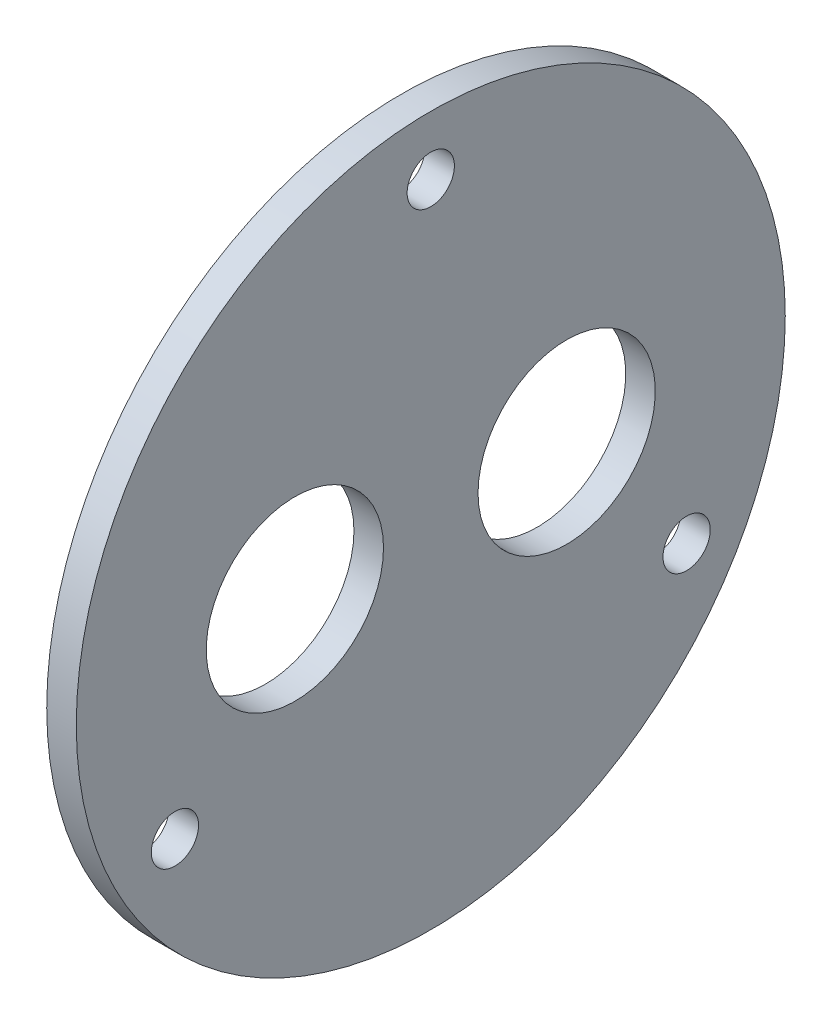
from build123d import *

# Parameters (mm, degrees)
SKETCH1_R           = 60
SKETCH1_R_2         = 4
SKETCH1_R_3         = 15
BOSS_EXTRUDE1_DEPTH = 5


with BuildPart() as part:
    # Sketch1 → Boss-Extrude1 (new body)
    with BuildSketch(Plane(origin=(0, 0, 0), x_dir=(0, 0, -1), z_dir=(1, 0, 0))):
        Circle(SKETCH1_R)
        with Locations((0, 50)):
            Circle(SKETCH1_R_2, mode=Mode.SUBTRACT)
        with Locations((43.301270189, -25)):
            Circle(SKETCH1_R_2, mode=Mode.SUBTRACT)
        with Locations((-43.301270189, -25)):
            Circle(SKETCH1_R_2, mode=Mode.SUBTRACT)
        with Locations((-23, 0)):
            Circle(SKETCH1_R_3, mode=Mode.SUBTRACT)
        with Locations((23, 0)):
            Circle(SKETCH1_R_3, mode=Mode.SUBTRACT)
    extrude(amount=BOSS_EXTRUDE1_DEPTH)


solid = part.part
